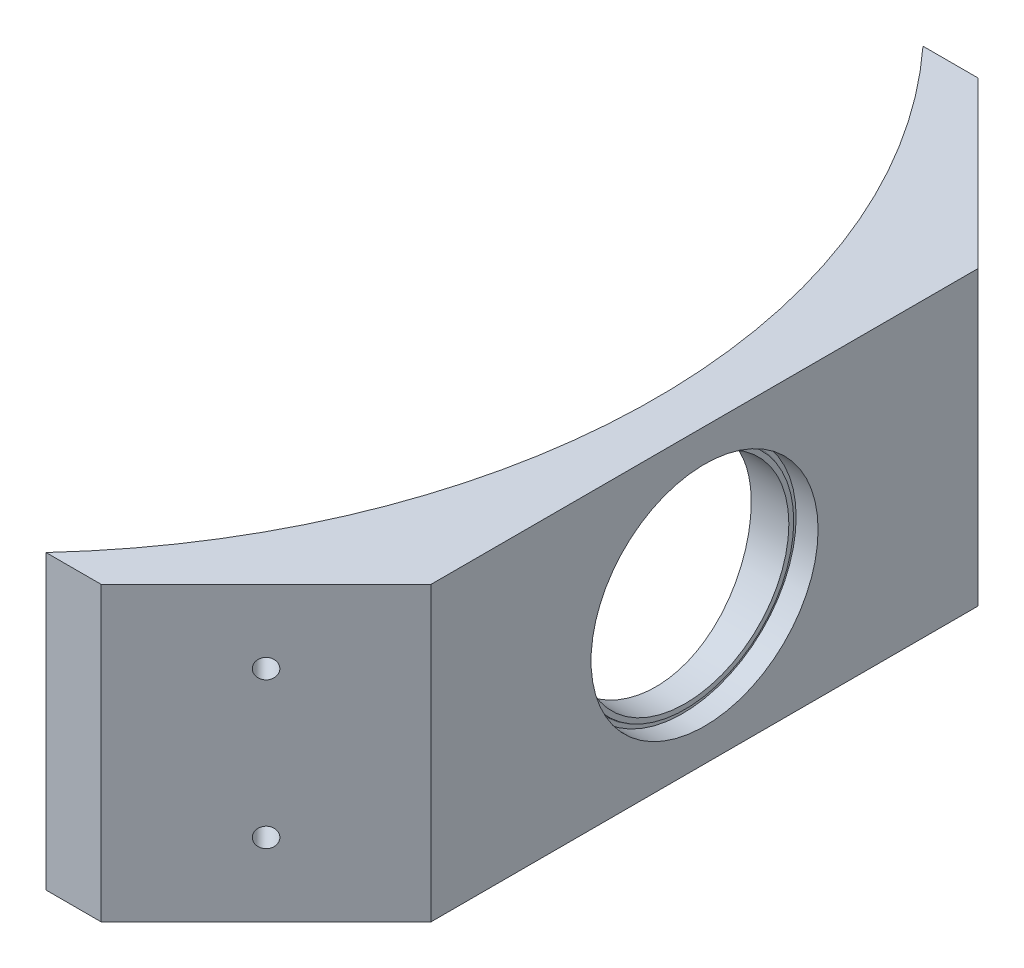
from build123d import *

# Parameters (mm, degrees)
SKETCH1_R           = 10.65
BOSS_EXTRUDE1_DEPTH = 4
CUT_EXTRUDE2_START  = -2
SKETCH4_R           = 11.65
SKETCH4_R_2         = 10.65
CUT_EXTRUDE2_DEPTH  = 2
CUT_EXTRUDE3_START  = -0.25
SKETCH5_R           = 11.65
SKETCH5_R_2         = 11.15
CUT_EXTRUDE3_DEPTH  = 0.25
FILLET1_R           = 0.1
BOSS_EXTRUDE3_DEPTH = 30
CUT_EXTRUDE6_START  = -30
SKETCH12_R          = 10.65
CUT_EXTRUDE6_DEPTH  = 30
CUT_EXTRUDE7_DEPTH  = 30
SKETCH14_R          = 1
CUT_EXTRUDE8_DEPTH  = 30
SKETCH15_R          = 1
CUT_EXTRUDE9_DEPTH  = 30


with BuildPart() as part:
    # Sketch1 → Boss-Extrude1 (new body)
    with BuildSketch(Plane(origin=(0, 0, 0), x_dir=(0, 0, -1), z_dir=(1, 0, 0))):
        Polygon((44.818066557, 64.750067007), (49.818066557, 64.750067007), (49.818066557, 34.750067007), (44.818066557, 34.750067007), (-35.181933443, 34.750067007), (-40.181933443, 34.750067007), (-40.181933443, 64.750067007), (-35.181933443, 64.750067007), align=None)
        with Locations((4.818066557, 49.750067007)):
            Circle(SKETCH1_R, mode=Mode.SUBTRACT)
    extrude(amount=BOSS_EXTRUDE1_DEPTH)

    # Sketch4 → Cut-Extrude2 (cut)
    with BuildSketch(Plane(origin=(4, 0, 0), x_dir=(0, 0, -1), z_dir=(1, 0, 0)).offset(CUT_EXTRUDE2_START)):
        with Locations((4.818066557, 49.750067007)):
            Circle(SKETCH4_R)
        with Locations((4.818066557, 49.750067007)):
            Circle(SKETCH4_R_2, mode=Mode.SUBTRACT)
    extrude(amount=CUT_EXTRUDE2_DEPTH, mode=Mode.SUBTRACT)

    # Sketch5 → Cut-Extrude3 (cut)
    with BuildSketch(Plane(origin=(2, 0, 0), x_dir=(0, 0, -1), z_dir=(1, 0, 0)).offset(CUT_EXTRUDE3_START)):
        with Locations((4.818066557, 49.750067007)):
            Circle(SKETCH5_R)
        with Locations((4.818066557, 49.750067007)):
            Circle(SKETCH5_R_2, mode=Mode.SUBTRACT)
    extrude(amount=CUT_EXTRUDE3_DEPTH, mode=Mode.SUBTRACT)

    # Fillet1
    fillet1_edges = [part.edges().sort_by_distance(p)[0] for p in [
        (1.75, 49.750067007, 6.331933443),
    ]]
    fillet(fillet1_edges, radius=FILLET1_R)

    # Sketch11 → Boss-Extrude3 (add)
    with BuildSketch(Plane(origin=(0, 64.750067007, 0), x_dir=(1, 0, 0), z_dir=(0, 1, 0))):
        with BuildLine():
            Line((0, 49.818066557), (0, -40.181933443))
            Line((0, -40.181933443), (-18.584993082, -40.181933443))
            ThreePointArc((-18.584993082, -40.181933443), (-1, 4.818066557), (-18.584993082, 49.818066557))
            Line((-18.584993082, 49.818066557), (0, 49.818066557))
        make_face()
    extrude(amount=-BOSS_EXTRUDE3_DEPTH)

    # Sketch12 → Cut-Extrude6 (cut)
    with BuildSketch(Plane(origin=(0, 0, 0), x_dir=(0, 0, -1), z_dir=(1, 0, 0)).offset(CUT_EXTRUDE6_START)):
        with Locations((4.818066557, 49.750067007)):
            Circle(SKETCH12_R)
    extrude(amount=CUT_EXTRUDE6_DEPTH, mode=Mode.SUBTRACT)

    # Sketch13 → Cut-Extrude7 (cut)
    with BuildSketch(Plane(origin=(0, 64.750067007, 0), x_dir=(1, 0, 0), z_dir=(0, 1, 0))):
        Polygon((-12.938744811, 49.818066557), (4, 32.879321746), (4, 49.818066557), align=None)
        Polygon((-12.938744811, -40.181933443), (4, -23.243188631), (4, -40.181933443), align=None)
    extrude(amount=-CUT_EXTRUDE7_DEPTH, mode=Mode.SUBTRACT)

    # Sketch14 → Cut-Extrude8 (cut)
    with BuildSketch(Plane(origin=(-109.620613418, 0, 136.863802049), x_dir=(-0.7071067811865562, 0, 0.7071067811865388), z_dir=(-0.7071067811865388, 0, -0.7071067811865562))):
        with Locations((-148.70631114, 57.250067007)):
            Circle(SKETCH14_R)
        with Locations((-148.70631114, 42.250067007)):
            Circle(SKETCH14_R)
    extrude(amount=CUT_EXTRUDE8_DEPTH, mode=Mode.SUBTRACT)

    # Sketch15 → Cut-Extrude9 (cut)
    with BuildSketch(Plane(origin=(18.539804897, 0, -18.339516848), x_dir=(0.7071067811865562, 0, 0.7071067811865388), z_dir=(-0.7071067811865388, 0, 0.7071067811865562))):
        with Locations((-32.398265563, 57.250067007)):
            Circle(SKETCH15_R)
        with Locations((-32.398265563, 42.250067007)):
            Circle(SKETCH15_R)
    extrude(amount=CUT_EXTRUDE9_DEPTH, mode=Mode.SUBTRACT)


solid = part.part
